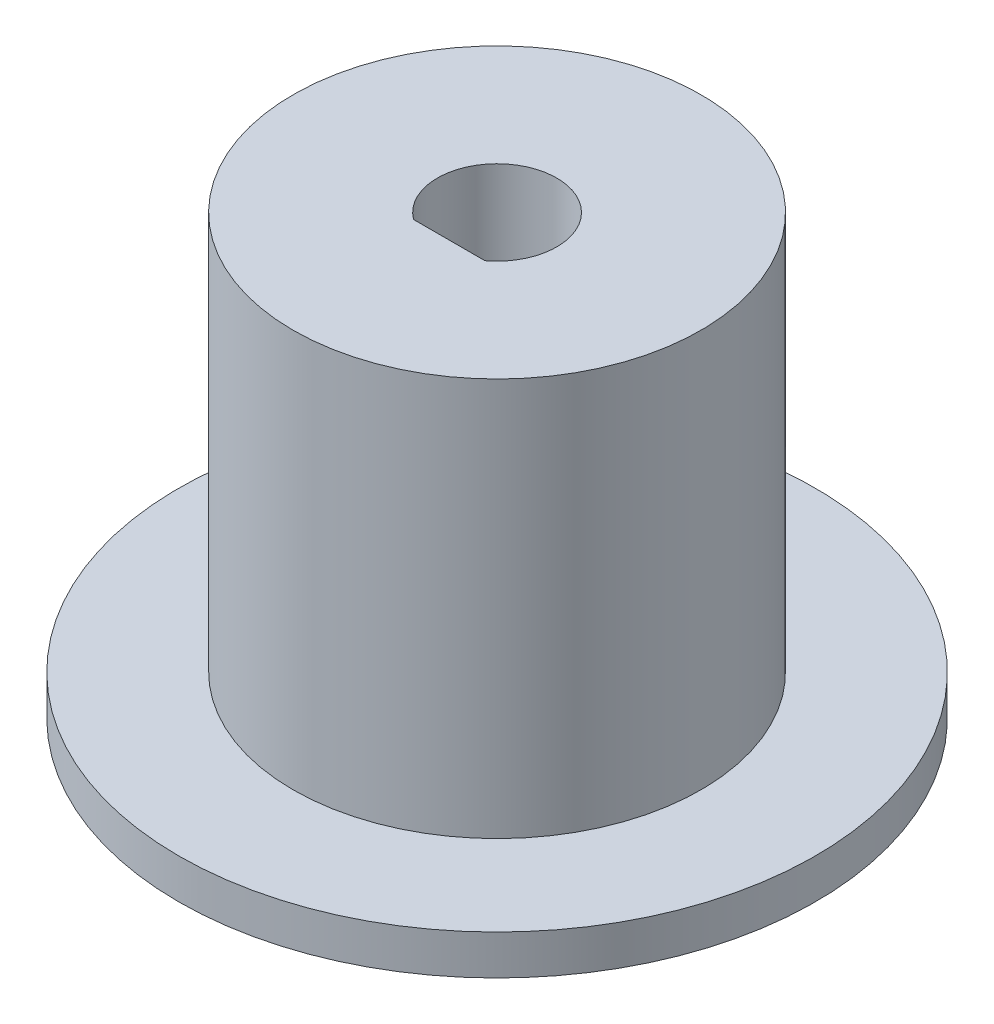
from build123d import *

# Parameters (mm, degrees)
SKETCH1_R           = 16
BOSS_EXTRUDE1_DEPTH = 2
SKETCH2_R           = 10.25
BOSS_EXTRUDE2_DEPTH = 20
CUT_EXTRUDE1_DEPTH  = 32.559467676


with BuildPart() as part:
    # Sketch1 → Boss-Extrude1 (new body)
    with BuildSketch(Plane(origin=(0, 0, 0), x_dir=(1, 0, 0), z_dir=(0, 1, 0))):
        Circle(SKETCH1_R)
    extrude(amount=BOSS_EXTRUDE1_DEPTH)

    # Sketch2 → Boss-Extrude2 (add)
    with BuildSketch(Plane(origin=(0, 2, 0), x_dir=(1, 0, 0), z_dir=(0, 1, 0))):
        Circle(SKETCH2_R)
    extrude(amount=BOSS_EXTRUDE2_DEPTH)

    # Sketch3 → Cut-Extrude1 (cut, through all)
    with BuildSketch(Plane.XZ):
        with BuildLine():
            ThreePointArc((-1.793973112, 2.404508365), (0, -3), (1.793973112, 2.404508365))
            Line((1.793973112, 2.404508365), (-1.793973112, 2.404508365))
        make_face()
    extrude(amount=-CUT_EXTRUDE1_DEPTH, mode=Mode.SUBTRACT)


solid = part.part
